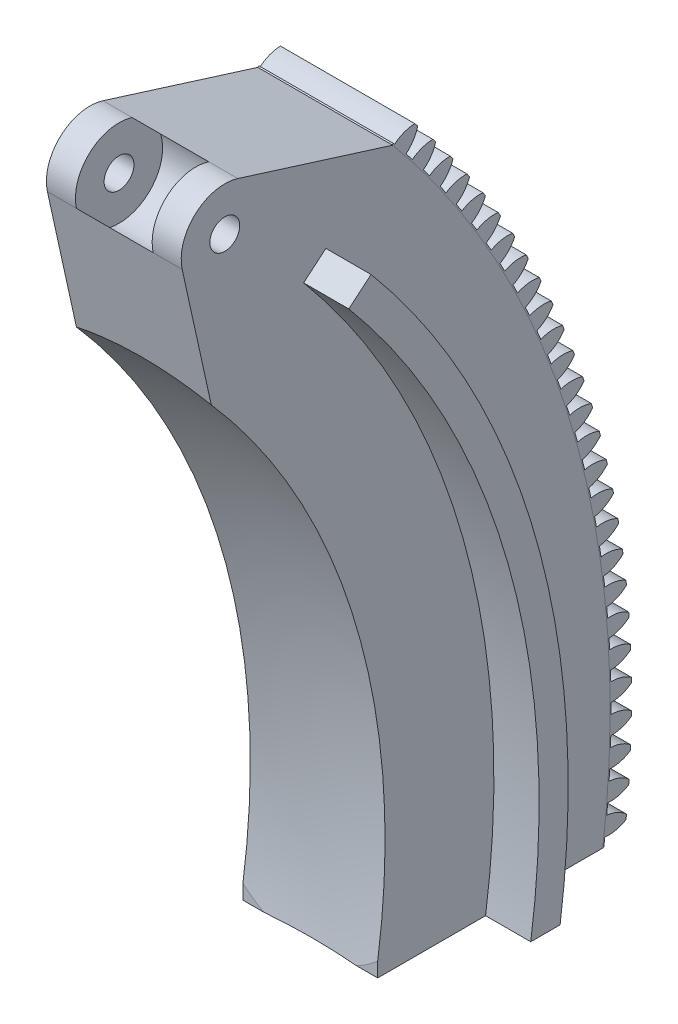
from build123d import *

# Parameters (mm, degrees)
BOSS_EXTRUDE2_DEPTH     = 6.35
BOSS_EXTRUDE3_START     = 29.464
BOSS_EXTRUDE3_DEPTH     = 29.464
CUT_EXTRUDE4_DEPTH      = 6.35
CIRPATTERN3_COUNT       = 206
CUT_EXTRUDE7_DEPTH      = 253.700667846
CUT_EXTRUDE7_DEPTH_BACK = 253.700667846
SKETCH15_R              = 3.2639
BOSS_EXTRUDE4_DEPTH     = 9.87425
BOSS_EXTRUDE6_START     = 23.01875
BOSS_EXTRUDE6_DEPTH     = 23.01875
CUT_EXTRUDE8_START      = 16.764
SKETCH28_R              = 9.525
CUT_EXTRUDE8_DEPTH      = 16.764


with BuildPart() as part:
    # Sketch11 → Boss-Extrude2 (new body)
    with BuildSketch(Plane(origin=(6.35, 0, 0), x_dir=(0, 0, -1), z_dir=(1, 0, 0))):
        with BuildLine():
            Line((159.337249268, 133.699827093), (155.660230842, 130.614442288))
            ThreePointArc((155.660230842, 130.614442288), (190.945540544, 69.498493124), (203.2, 0))
            ThreePointArc((203.2, 0), (202.801171077, -12.724975829), (201.606249903, -25.4))
            Line((201.606249903, -25.4), (206.443316116, -25.4))
            ThreePointArc((206.443316116, -25.4), (207.610469263, -12.72382888), (208.000006656, 0))
            ThreePointArc((208.000006656, 0), (195.456071378, 71.140192088), (159.337249268, 133.699827093))
        make_face()
    extrude(amount=-BOSS_EXTRUDE2_DEPTH)

    # Sketch1 → Boss-Extrude3 (add)
    with BuildSketch(Plane(origin=(0, 0, 0), x_dir=(0, 0, -1), z_dir=(1, 0, 0)).offset(BOSS_EXTRUDE3_START)):
        with BuildLine():
            Line((152.4, 0), (152.4, -25.4))
            Line((152.4, -25.4), (201.606249903, -25.4))
            ThreePointArc((201.606249903, -25.4), (202.801171077, -12.724975829), (203.2, 0))
            ThreePointArc((203.2, 0), (190.945540544, 69.498493124), (155.660230842, 130.614442288))
            Line((155.660230842, 130.614442288), (121.820004007, 141.220220575))
            ThreePointArc((121.820004007, 141.220220575), (112.535110183, 139.152511493), (109.669434309, 130.082088352))
            Line((109.669434309, 130.082088352), (116.745173131, 97.960831716))
            ThreePointArc((116.745173131, 97.960831716), (143.209155408, 52.123869843), (152.4, 0))
        make_face()
    extrude(amount=-BOSS_EXTRUDE3_DEPTH)

    # Sketch12 → Cut-Extrude4 (cut)
    with BuildSketch(Plane(origin=(6.35, 0, 0), x_dir=(0, 0, -1), z_dir=(1, 0, 0))):
        with BuildLine():
            ThreePointArc((203.496905889, 1.123362858), (206.492077476, 1.772772167), (208.969392364, 3.577126965))
            ThreePointArc((208.969392364, 3.577126965), (209.000006656, 0), (208.969392364, -3.577126965))
            ThreePointArc((208.969392364, -3.577126965), (206.492077476, -1.772772167), (203.496905889, -1.123362858))
            ThreePointArc((203.496905889, -1.123362858), (203.500006512, 0), (203.496905889, 1.123362858))
        make_face()
    cut_extrude4 = extrude(amount=-CUT_EXTRUDE4_DEPTH, mode=Mode.SUBTRACT)

    # CirPattern3: Cut-Extrude4 ×206 about axis
    cirpattern3_axis = Axis((0, 0, 0), (1, 0, 0))
    for i in range(1, CIRPATTERN3_COUNT):
        add(cut_extrude4.rotate(cirpattern3_axis, i * 360 / CIRPATTERN3_COUNT), mode=Mode.SUBTRACT)

    # Sketch15 → Cut-Extrude7 (cut, two sides: drawn at the far end of the back side and taken through both)
    with BuildSketch(Plane(origin=(6.35, 0, 0), x_dir=(0, 0, -1), z_dir=(1, 0, 0)).offset(-CUT_EXTRUDE7_DEPTH_BACK)):
        with Locations((118.971421811, 132.13114997)):
            Circle(SKETCH15_R)
    extrude(amount=CUT_EXTRUDE7_DEPTH + CUT_EXTRUDE7_DEPTH_BACK, mode=Mode.SUBTRACT)

    # Sketch21 → Cut-Revolve7 (revolve, cut)
    with BuildSketch(Plane(origin=(0, 0, 0), x_dir=(1, 0, 0), z_dir=(0, 1, 0))):
        with BuildLine():
            Line((-76.177622652, 38.1), (-102.108, 38.1))
            ThreePointArc((-102.108, 38.1), (14.732, 154.94), (131.572, 38.1))
            Line((131.572, 38.1), (105.641622652, 38.1))
            Line((105.641622652, 38.1), (-76.177622652, 38.1))
        make_face()
    revolve(axis=Axis((-1000, 0, 0), (1, 0, 0)), mode=Mode.SUBTRACT)

    # Sketch23 → Boss-Extrude4 (add)
    with BuildSketch(Plane(origin=(0, 0, 0), x_dir=(0, 0, -1), z_dir=(1, 0, 0))):
        with BuildLine():
            Line((136.202701987, 114.287637002), (141.0670842, 118.369338324))
            ThreePointArc((141.0670842, 118.369338324), (173.044396118, 62.983009393), (184.15, 0))
            ThreePointArc((184.15, 0), (183.709439007, -12.730456381), (182.389864028, -25.4))
            Line((182.389864028, -25.4), (175.976362049, -25.4))
            ThreePointArc((175.976362049, -25.4), (177.343504494, -12.732690754), (177.8, 0))
            ThreePointArc((177.8, 0), (167.077347976, 60.811181483), (136.202701987, 114.287637002))
        make_face()
    boss_extrude4 = extrude(amount=-BOSS_EXTRUDE4_DEPTH)

    # Mirror2: Boss-Extrude4 across plane
    add(boss_extrude4.mirror(Plane(origin=(14.732, 0, 0), x_dir=(0, 0, 1), z_dir=(1, 0, 0))))

    # Sketch27 → Boss-Extrude6 (add)
    with BuildSketch(Plane(origin=(6.35, 0, 0), x_dir=(0, 0, -1), z_dir=(1, 0, 0)).offset(BOSS_EXTRUDE6_START)):
        with BuildLine():
            Line((155.890049163, 130.807282757), (155.660230842, 130.614442288))
            ThreePointArc((155.660230842, 130.614442288), (194.922962004, 57.404519712), (201.606249903, -25.4))
            Line((201.606249903, -25.4), (201.908624507, -25.4))
            ThreePointArc((201.908624507, -25.4), (202.016697904, -24.525627784), (202.120984821, -23.650795875))
            ThreePointArc((202.120984821, -23.650795875), (204.52175744, -23.539887415), (206.761180022, -22.667536365))
            ThreePointArc((206.761180022, -22.667536365), (206.815923358, -22.162504697), (206.869433114, -21.657340837))
            ThreePointArc((206.869433114, -21.657340837), (204.865699514, -20.330290907), (202.54293904, -19.71320612))
            ThreePointArc((202.54293904, -19.71320612), (202.648674045, -18.594826116), (202.748233746, -17.475879472))
            ThreePointArc((202.748233746, -17.475879472), (205.144507443, -17.291808226), (207.356285067, -16.351569108))
            ThreePointArc((207.356285067, -16.351569108), (207.395601409, -15.845102875), (207.433680713, -15.338542133))
            ThreePointArc((207.433680713, -15.338542133), (205.390409142, -14.073215637), (203.049910298, -13.527253166))
            ThreePointArc((203.049910298, -13.527253166), (203.121489817, -12.406168826), (203.186879623, -11.284706433))
            ThreePointArc((203.186879623, -11.284706433), (205.576425306, -11.02764363), (207.758500503, -10.020391085))
            ThreePointArc((207.758500503, -10.020391085), (207.782353278, -9.51296142), (207.804966708, -9.005475015))
            ThreePointArc((207.804966708, -9.005475015), (205.724057883, -7.803049001), (203.36799788, -7.328716719))
            ThreePointArc((203.36799788, -7.328716719), (203.405355326, -6.205970912), (203.436514411, -5.083035991))
            ThreePointArc((203.436514411, -5.083035991), (205.817109245, -4.753220759), (207.967452178, -3.679891766))
            ThreePointArc((207.967452178, -3.679891766), (207.975819197, -3.171970697), (207.982945717, -2.664030709))
            ThreePointArc((207.982945717, -2.664030709), (205.866335368, -1.525623714), (203.496905889, -1.123362858))
            ThreePointArc((203.496905889, -1.123362858), (203.500006512, 0), (203.496905889, 1.123362858))
            ThreePointArc((203.496905889, 1.123362858), (205.866335368, 1.525623714), (207.982945717, 2.664030709))
            ThreePointArc((207.982945717, 2.664030709), (207.975819197, 3.171970697), (207.967452178, 3.679891766))
            ThreePointArc((207.967452178, 3.679891766), (205.817109245, 4.753220759), (203.436514411, 5.083035991))
            ThreePointArc((203.436514411, 5.083035991), (203.405355326, 6.205970912), (203.36799788, 7.328716719))
            ThreePointArc((203.36799788, 7.328716719), (205.724057883, 7.803049001), (207.804966708, 9.005475015))
            ThreePointArc((207.804966708, 9.005475015), (207.782353278, 9.51296142), (207.758500503, 10.020391085))
            ThreePointArc((207.758500503, 10.020391085), (205.576425306, 11.02764363), (203.186879623, 11.284706433))
            ThreePointArc((203.186879623, 11.284706433), (203.121489817, 12.406168826), (203.049910298, 13.527253166))
            ThreePointArc((203.049910298, 13.527253166), (205.390409142, 14.073215637), (207.433680713, 15.338542133))
            ThreePointArc((207.433680713, 15.338542133), (207.395601409, 15.845102875), (207.356285067, 16.351569108))
            ThreePointArc((207.356285067, 16.351569108), (205.144507443, 17.291808226), (202.748233746, 17.475879472))
            ThreePointArc((202.748233746, 17.475879472), (202.648674045, 18.594826116), (202.54293904, 19.71320612))
            ThreePointArc((202.54293904, 19.71320612), (204.865699514, 20.330290907), (206.869433114, 21.657340837))
            ThreePointArc((206.869433114, 21.657340837), (206.815923358, 22.162504697), (206.761180022, 22.667536365))
            ThreePointArc((206.761180022, 22.667536365), (204.52175744, 23.539887415), (202.120984821, 23.650795875))
            ThreePointArc((202.120984821, 23.650795875), (201.987347839, 24.766185889), (201.847555705, 25.880821204))
            ThreePointArc((201.847555705, 25.880821204), (204.150417103, 26.568454274), (206.112748792, 27.955993173))
            ThreePointArc((206.112748792, 27.955993173), (206.043858361, 28.45929023), (205.973738955, 28.962417538))
            ThreePointArc((205.973738955, 28.962417538), (203.708754599, 29.76606903), (201.305716335, 29.803711534))
            ThreePointArc((201.305716335, 29.803711534), (201.138126386, 30.914507345), (200.964407163, 32.0243611))
            ThreePointArc((200.964407163, 32.0243611), (203.245227287, 32.781902795), (205.164331641, 34.228639929))
            ThreePointArc((205.164331641, 34.228639929), (205.080124619, 34.729602), (204.994694371, 35.230356922))
            ThreePointArc((204.994694371, 35.230356922), (202.706255202, 35.964561273), (200.303186679, 35.928902803))
            ThreePointArc((200.303186679, 35.928902803), (200.10179966, 37.034071114), (199.894314948, 38.138110887))
            ThreePointArc((199.894314948, 38.138110887), (202.150972104, 38.964856516), (204.025063908, 40.469446082))
            ThreePointArc((204.025063908, 40.469446082), (203.925618628, 40.967607156), (203.824957007, 41.465523873))
            ThreePointArc((203.824957007, 41.465523873), (201.515191808, 42.129598103), (199.114328438, 42.020671831))
            ThreePointArc((199.114328438, 42.020671831), (198.879331686, 43.119184577), (198.638274493, 44.216383353))
            ThreePointArc((198.638274493, 44.216383353), (200.868669465, 45.111563851), (202.696005379, 46.672606232))
            ThreePointArc((202.696005379, 46.672606232), (202.581414347, 47.167502903), (202.465614992, 47.662118237))
            ThreePointArc((202.465614992, 47.662118237), (200.136672382, 48.255444601), (197.740247527, 48.073351853))
            ThreePointArc((197.740247527, 48.073351853), (197.471859644, 49.164187162), (197.197454209, 50.253524292))
            ThreePointArc((197.197454209, 50.253524292), (199.399512211, 51.216306932), (201.178392386, 52.832349994))
            ThreePointArc((201.178392386, 52.832349994), (201.048762199, 53.323521893), (200.917932831, 53.814375736))
            ThreePointArc((200.917932831, 53.814375736), (198.571979268, 54.336402303), (196.182222161, 54.081312469))
            ThreePointArc((196.182222161, 54.081312469), (195.88069281, 55.16345561), (195.573194395, 56.243917756))
            ThreePointArc((195.573194395, 56.243917756), (197.744867, 57.273406927), (199.473636663, 58.942947374))
            ThreePointArc((199.473636663, 58.942947374), (199.329087908, 59.429937596), (199.183350228, 59.916573341))
            ThreePointArc((199.183350228, 59.916573341), (196.822567995, 60.366814505), (194.441701666, 60.038964877))
            ThreePointArc((194.441701666, 60.038964877), (194.10731134, 61.111409204), (193.767005989, 62.181991286))
            ThreePointArc((193.767005989, 62.181991286), (195.906273036, 63.277229323), (197.583324031, 64.998714094))
            ThreePointArc((197.583324031, 64.998714094), (197.42399117, 65.481069626), (197.263480748, 65.963034587))
            ThreePointArc((197.263480748, 65.963034587), (194.890065923, 66.341071518), (192.520305132, 65.940767073))
            ThreePointArc((192.520305132, 65.940767073), (192.153364891, 67.002514964), (191.780569168, 68.062221091))
            ThreePointArc((191.780569168, 68.062221091), (193.885440641, 69.222189168), (195.509212918, 70.994016881))
            ThreePointArc((195.509212918, 70.994016881), (195.33524417, 71.471289019), (195.160110318, 71.948134857))
            ThreePointArc((195.160110318, 71.948134857), (192.776270728, 72.253615894), (190.419819905, 71.781229008))
            ThreePointArc((190.419819905, 71.781229008), (190.020671088, 72.831292791), (189.61573178, 73.879137189))
            ThreePointArc((189.61573178, 73.879137189), (191.684249659, 75.102756265), (193.253232733, 76.923278708))
            ThreePointArc((193.253232733, 76.923278708), (193.064789927, 77.395023479), (192.875195561, 77.866306616))
            ThreePointArc((192.875195561, 77.866306616), (190.483148732, 78.09894759), (188.142199924, 77.554917692))
            ThreePointArc((188.142199924, 77.554917692), (187.711213834, 78.592320563), (187.274507628, 79.627328493))
            ThreePointArc((187.274507628, 79.627328493), (189.304747709, 80.913460318), (190.81748206, 82.780983982))
            ThreePointArc((190.81748206, 82.780983982), (190.614740494, 83.246762552), (190.41086198, 83.712044586))
            ThreePointArc((190.41086198, 83.712044586), (188.012833073, 83.871629087), (185.689563906, 83.256462252))
            ThreePointArc((185.689563906, 83.256462252), (185.22714146, 84.280239185), (184.759074595, 85.301447849))
            ThreePointArc((184.759074595, 85.301447849), (186.749148282, 86.64889602), (188.204226716, 88.561683673))
            ThreePointArc((188.204226716, 88.561683673), (187.987374985, 89.021062761), (187.769401979, 89.479910871))
            ThreePointArc((187.769401979, 89.479910871), (185.367621717, 89.566290448), (183.064193374, 88.880558924))
            ThreePointArc((183.064193374, 88.880558924), (182.570764732, 89.889757567), (182.07177262, 90.896217003))
            ThreePointArc((182.07177262, 90.896217003), (184.019828682, 92.303728081), (185.415897636, 94.260000386))
            ThreePointArc((185.415897636, 94.260000386), (185.185137463, 94.712552661), (184.953272729, 95.164540011))
            ThreePointArc((184.953272729, 95.164540011), (182.549975329, 95.177634311), (180.268530534, 94.421975989))
            ThreePointArc((180.268530534, 94.421975989), (179.744554699, 95.415657553), (179.215101518, 96.40643152))
            ThreePointArc((179.215101518, 96.40643152), (181.119327809, 97.872696191), (182.455088615, 99.870633359))
            ThreePointArc((182.455088615, 99.870633359), (182.210634661, 100.315937843), (181.965093888, 100.76064398))
            ThreePointArc((181.965093888, 100.76064398), (179.562514975, 100.700440822), (177.305176002, 99.875558639))
            ThreePointArc((177.305176002, 99.875558639), (176.751140395, 100.852798769), (176.191718658, 101.826965616))
            ThreePointArc((176.191718658, 101.826965616), (178.050343805, 103.350619914), (179.324553894, 105.388363397))
            ThreePointArc((179.324553894, 105.388363397), (179.066633558, 105.826005854), (178.807645156, 106.263017097))
            ThreePointArc((178.807645156, 106.263017097), (176.408019688, 106.129572484), (174.176886388, 105.236233773))
            ThreePointArc((174.176886388, 105.236233773), (173.59330639, 106.196123408), (173.004436491, 107.152776934))
            ThreePointArc((173.004436491, 107.152776934), (174.81573154, 108.732403504), (176.0272056, 110.808057728))
            ThreePointArc((176.0272056, 110.808057728), (175.756058808, 111.237631047), (175.483863697, 111.666540875))
            ThreePointArc((175.483863697, 111.666540875), (173.089423883, 111.459978942), (170.886571729, 110.499014716))
            ThreePointArc((170.886571729, 110.499014716), (170.273990206, 111.440660935), (169.656219931, 112.378911229))
            ThreePointArc((169.656219931, 112.378911229), (171.418499956, 114.013040652), (172.566111034, 116.124674775))
            ThreePointArc((172.566111034, 116.124674775), (172.281990016, 116.545779353), (171.996841399, 116.96618878))
            ThreePointArc((171.996841399, 116.96618878), (169.609814626, 116.686701677), (167.437292784, 115.659005856))
            ThreePointArc((167.437292784, 115.659005856), (166.796279579, 116.58153271), (166.150183599, 117.50050698))
            ThreePointArc((166.150183599, 117.50050698), (167.861809268, 119.187619135), (168.944489819, 121.333268845))
            ThreePointArc((168.944489819, 121.333268845), (168.647658873, 121.745512958), (168.349822006, 122.157030904))
            ThreePointArc((168.349822006, 122.157030904), (165.972428765, 121.80487862), (163.832258185, 120.7114072))
            ThreePointArc((163.832258185, 120.7114072), (163.16340959, 121.613956524), (162.489588923, 122.512799911))
            ThreePointArc((162.489588923, 122.512799911), (164.148968027, 124.251325391), (165.165710906, 126.428994735))
            ThreePointArc((165.165710906, 126.428994735), (164.856446155, 126.831994899), (164.546198095, 127.234238558))
            ThreePointArc((164.546198095, 127.234238558), (162.180649914, 126.809748675), (160.074821454, 125.65151884))
            ThreePointArc((160.074821454, 125.65151884), (159.378759653, 126.533251052), (158.67784111, 127.411127423))
            ThreePointArc((158.67784111, 127.411127423), (160.28343004, 129.199448994), (161.23328944, 131.407112233))
            ThreePointArc((161.23328944, 131.407112233), (160.91187857, 131.800493565), (160.589507921, 132.193088755))
            ThreePointArc((160.589507921, 132.193088755), (158.238005311, 131.696656149), (156.168477881, 130.474745321))
            ThreePointArc((156.168477881, 130.474745321), (156.029352112, 130.641088214), (155.890049163, 130.807282757))
        make_face()
    extrude(amount=-BOSS_EXTRUDE6_DEPTH)

    # Sketch28 → Cut-Extrude8 (cut)
    with BuildSketch(Plane(origin=(6.35, 0, 0), x_dir=(0, 0, -1), z_dir=(1, 0, 0)).offset(CUT_EXTRUDE8_START)):
        with Locations((118.971421811, 132.13114997)):
            Circle(SKETCH28_R)
    extrude(amount=-CUT_EXTRUDE8_DEPTH, mode=Mode.SUBTRACT)


solid = part.part
